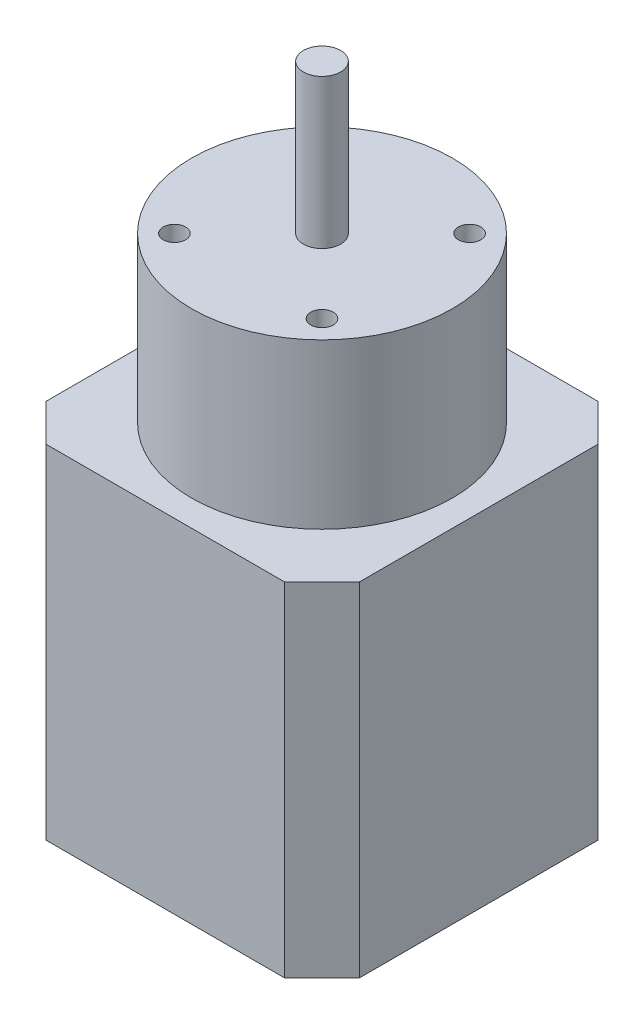
from build123d import *

# Parameters (mm, degrees)
SKETCH1_W           = 42
SKETCH1_H           = 42
BOSS_EXTRUDE1_DEPTH = 46
CHAMFER1_SIZE       = 5
SKETCH5_R           = 17.5
BOSS_EXTRUDE4_DEPTH = 22
SKETCH6_R           = 2.5
BOSS_EXTRUDE5_DEPTH = 20
SKETCH7_R           = 1.5
CUT_EXTRUDE2_DEPTH  = 5


with BuildPart() as part:
    # Sketch1 → Boss-Extrude1 (new body)
    with BuildSketch(Plane(origin=(0, 0, 0), x_dir=(1, 0, 0), z_dir=(0, 1, 0))):
        Rectangle(SKETCH1_W, SKETCH1_H)
    extrude(amount=BOSS_EXTRUDE1_DEPTH)

    # Chamfer1
    chamfer1_edges = [part.edges().sort_by_distance(p)[0] for p in [
        (-21, 23, -21),
        (21, 23, -21),
        (21, 23, 21),
        (-21, 23, 21),
    ]]
    chamfer(chamfer1_edges, length=CHAMFER1_SIZE)

    # Sketch5 → Boss-Extrude4 (add)
    with BuildSketch(Plane(origin=(0, 46, 0), x_dir=(1, 0, 0), z_dir=(0, 1, 0))):
        Circle(SKETCH5_R)
    extrude(amount=BOSS_EXTRUDE4_DEPTH)

    # Sketch6 → Boss-Extrude5 (add)
    with BuildSketch(Plane(origin=(0, 68, 0), x_dir=(1, 0, 0), z_dir=(0, 1, 0))):
        Circle(SKETCH6_R)
    extrude(amount=BOSS_EXTRUDE5_DEPTH)

    # Sketch7 → Cut-Extrude2 (cut)
    with BuildSketch(Plane(origin=(0, 68, 0), x_dir=(1, 0, 0), z_dir=(0, 1, 0))):
        with Locations((-9.899494937, 9.899494937)):
            Circle(SKETCH7_R)
        with Locations((9.899494937, 9.899494937)):
            Circle(SKETCH7_R)
        with Locations((9.899494937, -9.899494937)):
            Circle(SKETCH7_R)
        with Locations((-9.899494937, -9.899494937)):
            Circle(SKETCH7_R)
    extrude(amount=-CUT_EXTRUDE2_DEPTH, mode=Mode.SUBTRACT)


solid = part.part
